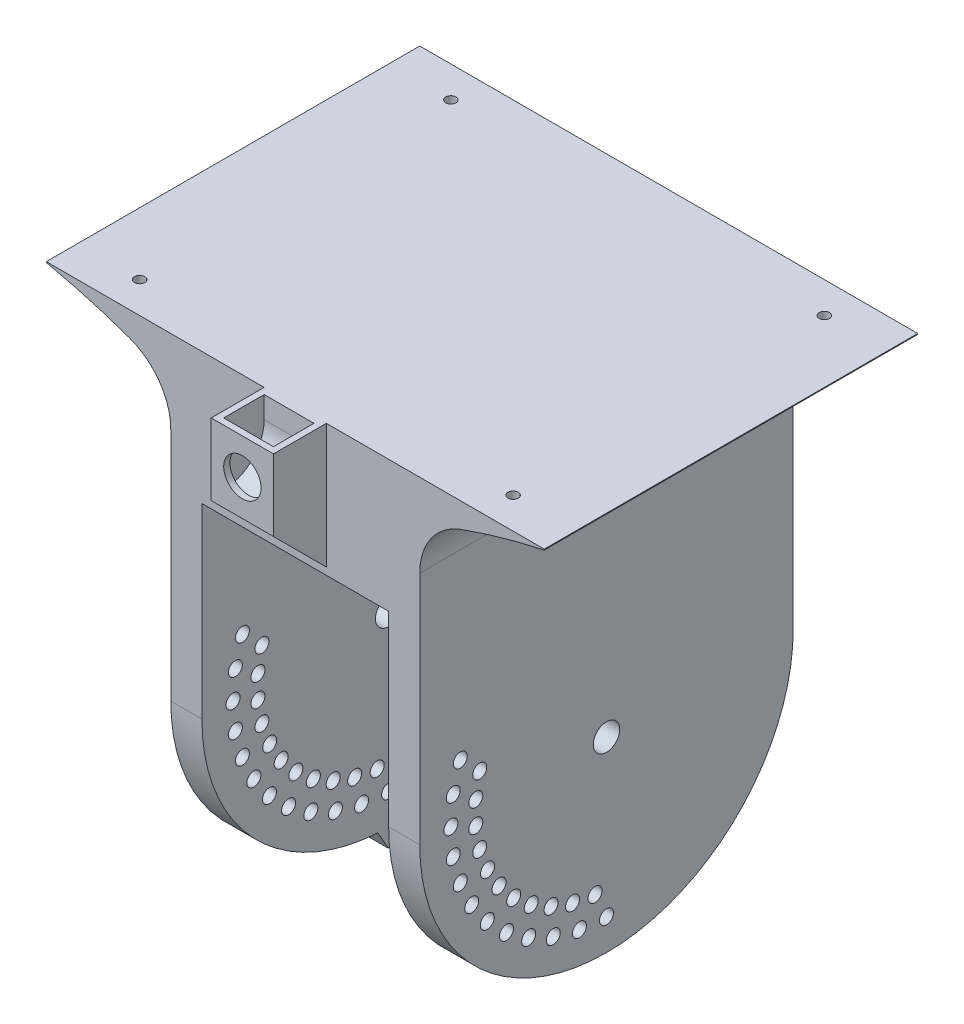
from build123d import *

# Parameters (mm, degrees)
BOSS_EXTRUDE1_DEPTH = 120
SKETCH2_W           = 80
SKETCH2_H           = 30
BOSS_EXTRUDE2_DEPTH = 120
FILLET1_R           = 20
SKETCH3_W           = 10
SKETCH3_H           = 120
BOSS_EXTRUDE3_DEPTH = 120
FILLET2_R           = 60
SKETCH4_R           = 4.25
SKETCH4_R_2         = 2.25
CUT_EXTRUDE1_DEPTH  = 406.975263542
SKETCH6_W           = 20
SKETCH6_H           = 17
SKETCH6_W_2         = 16
SKETCH6_H_2         = 13
BOSS_EXTRUDE4_DEPTH = 20
SKETCH7_W           = 20
SKETCH7_H           = 17
BOSS_EXTRUDE5_DEPTH = 3
FILLET3_R           = 13
SKETCH8_R           = 6
CUT_EXTRUDE2_DEPTH  = 3
CHAMFER1_SIZE       = 17
SKETCH10_R          = 1.65
CUT_EXTRUDE3_DEPTH  = 218.122958345
SKETCH11_R          = 3
CUT_EXTRUDE4_DEPTH  = 215.149368903
BOSS_EXTRUDE6_DEPTH = 10


with BuildPart() as part:
    # Sketch1 → Boss-Extrude1 (new body)
    with BuildSketch(Plane.XY):
        with BuildLine():
            Line((80, -206.5), (-80, -206.5))
            Line((-80, -206.5), (-80, -206.771199773))
            ThreePointArc((-80, -206.771199773), (-65.350122978, -210.451524762), (-51.0095809, -215.196263078))
            ThreePointArc((-51.0095809, -215.196263078), (0, -224.378994833), (51.0095809, -215.196263078))
            ThreePointArc((51.0095809, -215.196263078), (65.350122978, -210.451524762), (80, -206.771199773))
            Line((80, -206.771199773), (80, -206.5))
        make_face()
    extrude(amount=-BOSS_EXTRUDE1_DEPTH)

    # Sketch2 → Boss-Extrude2 (add)
    with BuildSketch(Plane(origin=(0, 0, -120), x_dir=(-1, 0, 0), z_dir=(0, 0, -1))):
        with Locations((0, -233.803354766)):
            Rectangle(SKETCH2_W, SKETCH2_H)
    extrude(amount=-BOSS_EXTRUDE2_DEPTH)

    # Fillet1
    fillet1_edges = [part.edges().sort_by_distance(p)[0] for p in [
        (40, -218.803354766, -60),
        (-40, -218.803354766, -60),
    ]]
    fillet(fillet1_edges, radius=FILLET1_R)

    # Sketch3 → Boss-Extrude3 (add)
    with BuildSketch(Plane.XZ.offset(248.803354766)):
        with Locations((35, -60)):
            Rectangle(SKETCH3_W, SKETCH3_H)
        with Locations((-35, -60)):
            Rectangle(SKETCH3_W, SKETCH3_H)
    extrude(amount=BOSS_EXTRUDE3_DEPTH)

    # Fillet2
    fillet2_edges = [part.edges().sort_by_distance(p)[0] for p in [
        (35, -368.803354766, -120),
        (35, -368.803354766, 0),
        (-35, -368.803354766, 0),
        (-35, -368.803354766, -120),
    ]]
    fillet(fillet2_edges, radius=FILLET2_R - 0.0001)  # a hair under: the kernel refuses the full size

    # Sketch4 → Cut-Extrude1 (cut, through all)
    with BuildSketch(Plane.ZY.offset(40)):
        with Locations(Location((-60, -308.803354766, 0), (0, 0, 270))):
            Circle(SKETCH4_R)
        with Locations(Location((-60, -358.803354766, 0), (0, 0, 270))):
            Circle(SKETCH4_R_2)
        with Locations(Location((-51.317591117, -358.043742416, 0), (0, 0, 270))):
            Circle(SKETCH4_R_2)
        with Locations(Location((-42.898992834, -355.787985805, 0), (0, 0, 270))):
            Circle(SKETCH4_R_2)
        with Locations(Location((-35, -352.104624955, 0), (0, 0, 270))):
            Circle(SKETCH4_R_2)
        with Locations(Location((-27.860619516, -347.105576922, 0), (0, 0, 270))):
            Circle(SKETCH4_R_2)
        with Locations(Location((-21.697777844, -340.94273525, 0), (0, 0, 270))):
            Circle(SKETCH4_R_2)
        with Locations(Location((-16.698729811, -333.803354766, 0), (0, 0, 270))):
            Circle(SKETCH4_R_2)
        with Locations(Location((-13.015368961, -325.904361932, 0), (0, 0, 270))):
            Circle(SKETCH4_R_2)
        with Locations(Location((-10.759612349, -317.485763649, 0), (0, 0, 270))):
            Circle(SKETCH4_R_2)
        with Locations(Location((-10, -308.803354766, 0), (0, 0, 270))):
            Circle(SKETCH4_R_2)
        with Locations(Location((-10.759612349, -300.120945882, 0), (0, 0, 270))):
            Circle(SKETCH4_R_2)
        with Locations(Location((-13.015368961, -291.702347599, 0), (0, 0, 270))):
            Circle(SKETCH4_R_2)
        with Locations(Location((-56.325476132, -350.803354766, 0), (0, 0, 270))):
            Circle(SKETCH4_R_2)
        with Locations(Location((-49.088076944, -349.527206019, 0), (0, 0, 270))):
            Circle(SKETCH4_R_2)
        with Locations(Location((-42.182231017, -347.013683659, 0), (0, 0, 270))):
            Circle(SKETCH4_R_2)
        with Locations(Location((-35.817768983, -343.339159791, 0), (0, 0, 270))):
            Circle(SKETCH4_R_2)
        with Locations(Location((-30.188071803, -338.615282963, 0), (0, 0, 270))):
            Circle(SKETCH4_R_2)
        with Locations(Location((-25.464194975, -332.985585782, 0), (0, 0, 270))):
            Circle(SKETCH4_R_2)
        with Locations(Location((-21.789671107, -326.621123749, 0), (0, 0, 270))):
            Circle(SKETCH4_R_2)
        with Locations(Location((-19.276148747, -319.715277822, 0), (0, 0, 270))):
            Circle(SKETCH4_R_2)
        with Locations(Location((-18, -312.477878634, 0), (0, 0, 270))):
            Circle(SKETCH4_R_2)
        with Locations(Location((-18, -305.128830898, 0), (0, 0, 270))):
            Circle(SKETCH4_R_2)
        with Locations(Location((-19.276148747, -297.89143171, 0), (0, 0, 270))):
            Circle(SKETCH4_R_2)
    extrude(amount=-CUT_EXTRUDE1_DEPTH, mode=Mode.SUBTRACT)

    # Sketch6 → Boss-Extrude4 (add)
    with BuildSketch(Plane(origin=(0, -206.5, 0), x_dir=(1, 0, 0), z_dir=(0, 1, 0))):
        with Locations((0, -8.5)):
            Rectangle(SKETCH6_W, SKETCH6_H)
        with Locations((0, -8.5)):
            Rectangle(SKETCH6_W_2, SKETCH6_H_2, mode=Mode.SUBTRACT)
    extrude(amount=-BOSS_EXTRUDE4_DEPTH)

    # Sketch7 → Boss-Extrude5 (add)
    with BuildSketch(Plane.XZ.offset(226.5)):
        with Locations((0, 8.5)):
            Rectangle(SKETCH7_W, SKETCH7_H)
    extrude(amount=BOSS_EXTRUDE5_DEPTH)

    # Fillet3
    fillet3_edges = [part.edges().sort_by_distance(p)[0] for p in [
        (0, -226.5, 2),
    ]]
    fillet(fillet3_edges, radius=FILLET3_R - 0.0001)  # a hair under: the kernel refuses the full size

    # Sketch8 → Cut-Extrude2 (cut)
    with BuildSketch(Plane.XY.offset(17)):
        with Locations((0, -218)):
            Circle(SKETCH8_R)
    extrude(amount=-CUT_EXTRUDE2_DEPTH, mode=Mode.SUBTRACT)

    # Chamfer1
    chamfer1_edges = [part.edges().sort_by_distance(p)[0] for p in [
        (0, -229.5, 0),
    ]]
    chamfer(chamfer1_edges, length=CHAMFER1_SIZE - 0.0001)  # a hair under: the kernel refuses the full size

    # Sketch10 → Cut-Extrude3 (cut, through all)
    with BuildSketch(Plane(origin=(0, -206.5, 0), x_dir=(1, 0, 0), z_dir=(0, 1, 0))):
        with Locations(Location((-60, 110, 0), (0, 0, 270))):
            Circle(SKETCH10_R)
        with Locations(Location((-60, 10, 0), (0, 0, 270))):
            Circle(SKETCH10_R)
        with Locations(Location((60, 10, 0), (0, 0, 270))):
            Circle(SKETCH10_R)
        with Locations(Location((60, 110, 0), (0, 0, 270))):
            Circle(SKETCH10_R)
    extrude(amount=-CUT_EXTRUDE3_DEPTH, mode=Mode.SUBTRACT)

    # Sketch11 → Cut-Extrude4 (cut, through all)
    with BuildSketch(Plane(origin=(0, -210.5, 0), x_dir=(1, 0, 0), z_dir=(0, 1, 0))):
        with Locations(Location((-60, 110, 0), (0, 0, 270))):
            Circle(SKETCH11_R)
        with Locations(Location((-60, 10, 0), (0, 0, 270))):
            Circle(SKETCH11_R)
        with Locations(Location((60, 110, 0), (0, 0, 270))):
            Circle(SKETCH11_R)
        with Locations(Location((60, 10, 0), (0, 0, 270))):
            Circle(SKETCH11_R)
    extrude(amount=-CUT_EXTRUDE4_DEPTH, mode=Mode.SUBTRACT)

    # Sketch13 → Boss-Extrude6 (add)
    with BuildSketch(Plane.ZY.offset(40)):
        Polygon((-60, -374.803354766), (-63.515300685, -368.700288419), (-60, -366.67551297), (-56.484699315, -368.700288419), align=None)
    extrude(amount=-BOSS_EXTRUDE6_DEPTH)


solid = part.part
